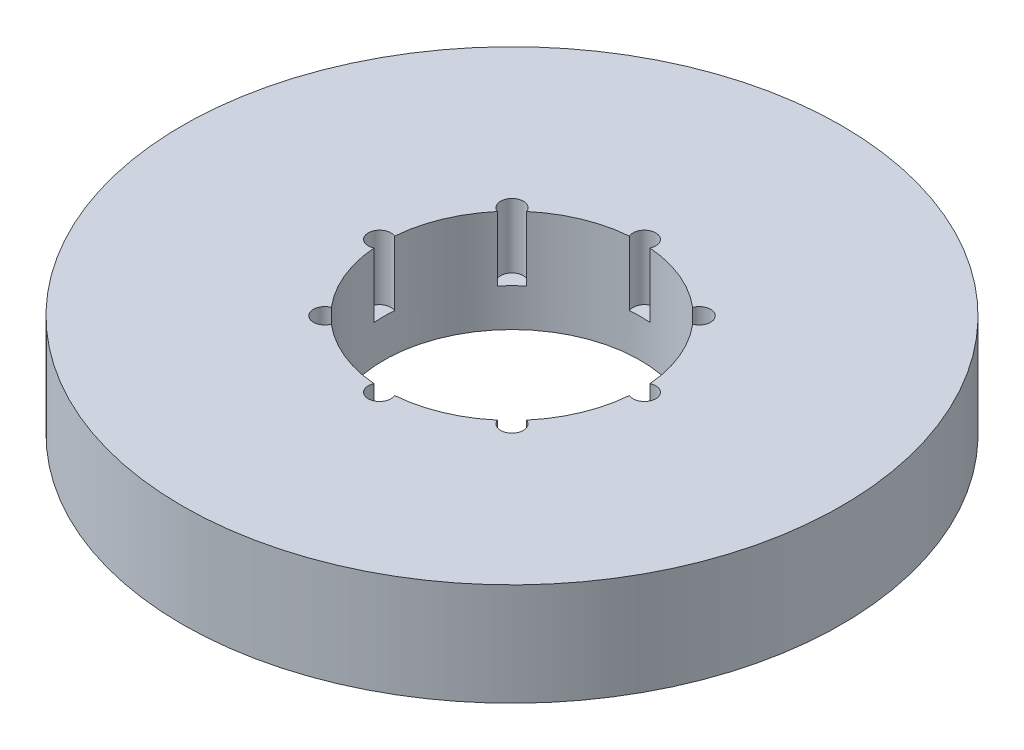
from build123d import *

# Parameters (mm, degrees)
SKETCH1_R           = 90
BOSS_EXTRUDE1_DEPTH = 28
SKETCH2_R           = 35
CUT_EXTRUDE1_DEPTH  = 131.322676461
SKETCH3_R           = 3.089317746
CUT_EXTRUDE2_DEPTH  = 17.62472394
CIRPATTERN1_COUNT   = 8


with BuildPart() as part:
    # Sketch1 → Boss-Extrude1 (new body)
    with BuildSketch(Plane(origin=(0, 0, 0), x_dir=(1, 0, 0), z_dir=(0, 1, 0))):
        Circle(SKETCH1_R)
    extrude(amount=BOSS_EXTRUDE1_DEPTH)

    # Sketch2 → Cut-Extrude1 (cut, through all)
    with BuildSketch(Plane(origin=(0, 0, 0), x_dir=(1, 0, 0), z_dir=(0, 1, 0))):
        Circle(SKETCH2_R)
    extrude(amount=CUT_EXTRUDE1_DEPTH, mode=Mode.SUBTRACT)

    # Sketch3 → Cut-Extrude2 (cut)
    with BuildSketch(Plane(origin=(0, 28, 0), x_dir=(1, 0, 0), z_dir=(0, 1, 0))):
        with Locations((-36.161856648, 0)):
            Circle(SKETCH3_R)
    cut_extrude2 = extrude(amount=-CUT_EXTRUDE2_DEPTH, mode=Mode.SUBTRACT)

    # CirPattern1: Cut-Extrude2 ×8 about axis
    cirpattern1_axis = Axis((0, 0, 0), (0, 1, 0))
    for i in range(1, CIRPATTERN1_COUNT):
        add(cut_extrude2.rotate(cirpattern1_axis, i * 360 / CIRPATTERN1_COUNT), mode=Mode.SUBTRACT)


solid = part.part
